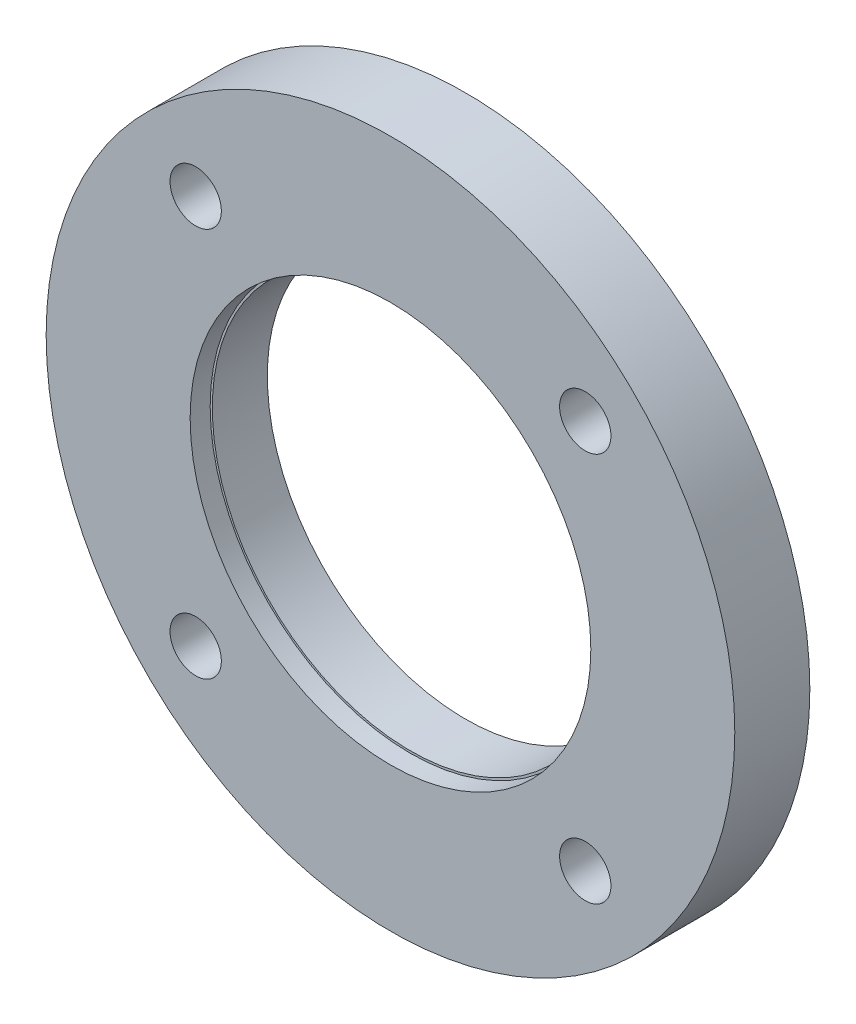
from build123d import *

# Parameters (mm, degrees)
SKETCH2_R          = 2.05
CUT_EXTRUDE1_DEPTH = 40.350070343


with BuildPart() as part:
    # Sketch1 → Revolve1 (revolve)
    with BuildSketch(Plane(origin=(0, 0, 0), x_dir=(1, 0, 0), z_dir=(0, 1, 0))):
        Polygon((-15.83, 0), (-27.5, 0), (-27.5, -5.994), (-16, -5.994), (-16, -4.394), (-15.83, -4.394), align=None)
    revolve(axis=Axis((0, 0, 1.024477222), (0, 0, -1)))

    # Sketch2 → Cut-Extrude1 (cut, through all)
    with BuildSketch(Plane.XY):
        with Locations((-15.556349186, 15.556349186)):
            Circle(SKETCH2_R)
        with Locations((15.556349186, 15.556349186)):
            Circle(SKETCH2_R)
        with Locations((15.556349186, -15.556349186)):
            Circle(SKETCH2_R)
        with Locations((-15.556349186, -15.556349186)):
            Circle(SKETCH2_R)
    extrude(amount=CUT_EXTRUDE1_DEPTH, mode=Mode.SUBTRACT)


solid = part.part
